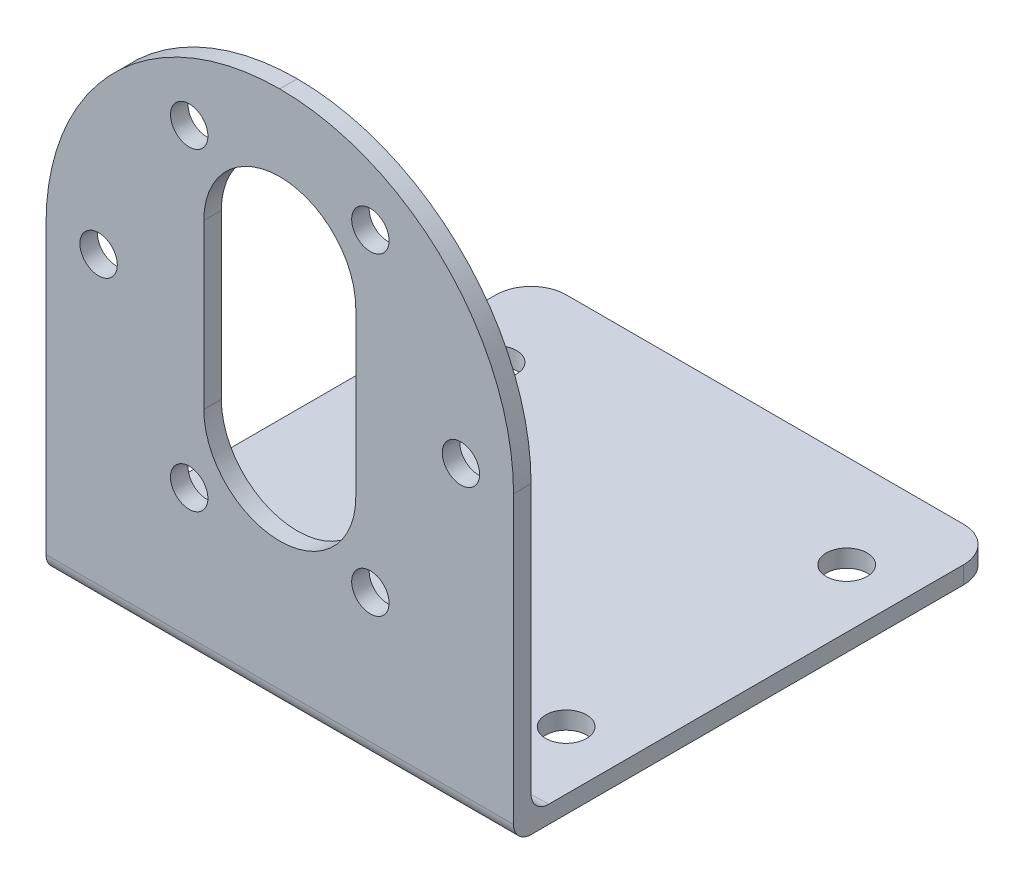
from build123d import *

# Parameters (mm, degrees)
BOSS_EXTRUDE1_DEPTH = 40
SKETCH2_R           = 1.75
CUT_EXTRUDE1_DEPTH  = 40
FILLET1_R           = 3
FILLET2_R           = 20
SKETCH3_R           = 1.6
CUT_EXTRUDE2_DEPTH  = 40
FILLET3_R           = 1.5


with BuildPart() as part:
    # Sketch1 → Boss-Extrude1 (new body)
    with BuildSketch(Plane(origin=(0, 0, 0), x_dir=(0, 0, -1), z_dir=(1, 0, 0))):
        Polygon((0, 0), (40, 0), (40, -1.5), (-1.5, -1.5), (-1.5, 44.5), (0, 44.5), align=None)
    extrude(amount=BOSS_EXTRUDE1_DEPTH)

    # Sketch2 → Cut-Extrude1 (cut)
    with BuildSketch(Plane.XZ.offset(1.5)):
        with Locations(Location((5, -32, 0), (0, 0, 270))):
            Circle(SKETCH2_R)
        with Locations(Location((5, -8, 0), (0, 0, 270))):
            Circle(SKETCH2_R)
        with Locations(Location((35, -8, 0), (0, 0, 270))):
            Circle(SKETCH2_R)
        with Locations(Location((35, -32, 0), (0, 0, 270))):
            Circle(SKETCH2_R)
    extrude(amount=-CUT_EXTRUDE1_DEPTH, mode=Mode.SUBTRACT)

    # Fillet1
    fillet1_edges = [part.edges().sort_by_distance(p)[0] for p in [
        (40, -0.75, -40),
        (0, -0.75, -40),
    ]]
    fillet(fillet1_edges, radius=FILLET1_R)

    # Fillet2
    fillet2_edges = [part.edges().sort_by_distance(p)[0] for p in [
        (40, 44.5, 0.75),
        (0, 44.5, 0.75),
    ]]
    fillet(fillet2_edges, radius=FILLET2_R - 0.0001)  # a hair under: the kernel refuses the full size

    # Sketch3 → Cut-Extrude2 (cut)
    with BuildSketch(Plane.XY.offset(1.5)):
        with Locations((4.5, 24.5)):
            Circle(SKETCH3_R)
        with Locations((12.25, 37.923393759)):
            Circle(SKETCH3_R)
        with Locations((27.75, 37.923393759)):
            Circle(SKETCH3_R)
        with Locations((35.5, 24.5)):
            Circle(SKETCH3_R)
        with Locations((27.75, 11.076606241)):
            Circle(SKETCH3_R)
        with Locations((12.25, 11.076606241)):
            Circle(SKETCH3_R)
        with BuildLine():
            Line((26.5, 31.5), (26.5, 17.5))
            ThreePointArc((26.5, 17.5), (20, 11), (13.5, 17.5))
            Line((13.5, 17.5), (13.5, 31.5))
            ThreePointArc((13.5, 31.5), (20, 38), (26.5, 31.5))
        make_face()
    extrude(amount=-CUT_EXTRUDE2_DEPTH, mode=Mode.SUBTRACT)

    # Fillet3
    fillet3_edges = [part.edges().sort_by_distance(p)[0] for p in [
        (20, 0, 0),
        (20, -1.5, 1.5),
    ]]
    fillet(fillet3_edges, radius=FILLET3_R)


solid = part.part
